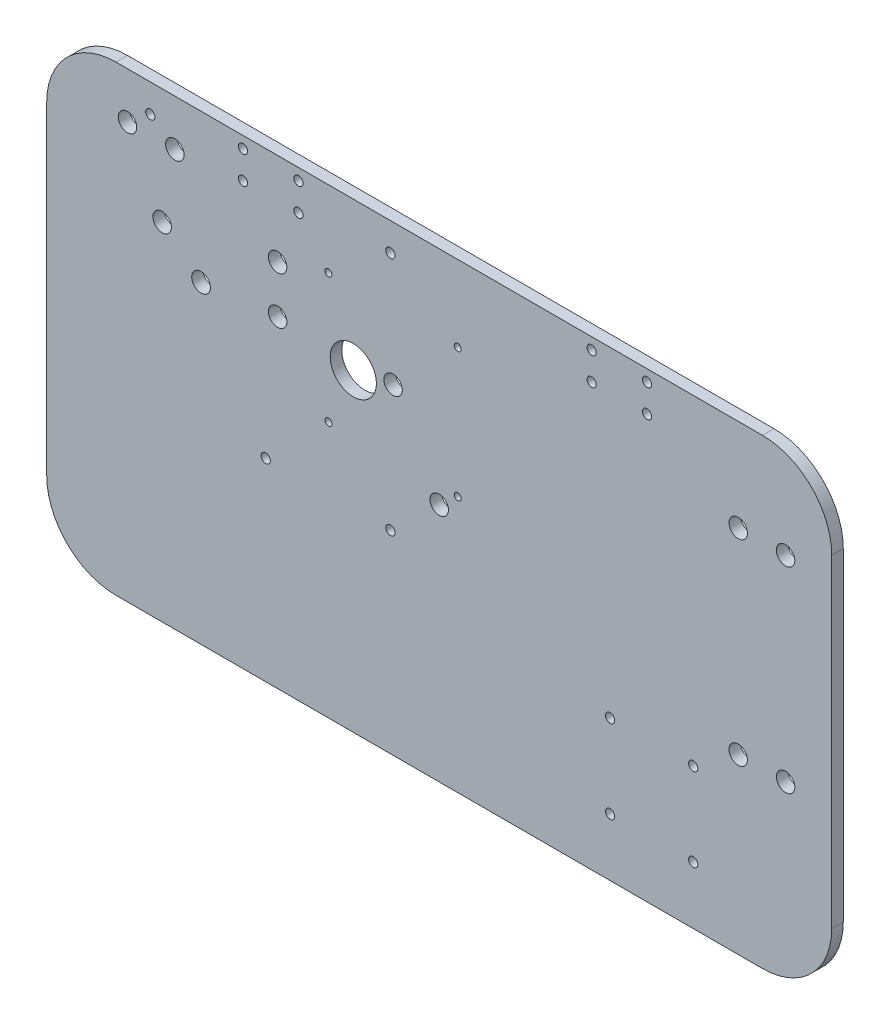
from build123d import *

# Parameters (mm, degrees)
SALIENTE_EXTRUIR1_DEPTH = 5
CROQUIS2_R              = 4
CORTAR_EXTRUIR4_DEPTH   = 10
CROQUIS3_R              = 2
CROQUIS3_R_2            = 10
CROQUIS3_R_3            = 4.05
CORTAR_EXTRUIR5_DEPTH   = 10
CROQUIS5_R              = 1.5
CORTAR_EXTRUIR6_DEPTH   = 10
CROQUIS6_R              = 2
CORTAR_EXTRUIR7_DEPTH   = 10
CROQUIS8_R              = 2
CORTAR_EXTRUIR8_DEPTH   = 10


with BuildPart() as part:
    # Croquis1 → Saliente-Extruir1 (new body)
    with BuildSketch(Plane.XY):
        with BuildLine():
            Line((30, 0), (310, 0))
            ThreePointArc((310, 0), (331.213203436, 8.786796564), (340, 30))
            Line((340, 30), (340, 170))
            ThreePointArc((340, 170), (331.213203436, 191.213203436), (310, 200))
            Line((310, 200), (30, 200))
            ThreePointArc((30, 200), (8.786796564, 191.213203436), (0, 170))
            Line((0, 170), (0, 30))
            ThreePointArc((0, 30), (8.786796564, 8.786796564), (30, 0))
        make_face()
    extrude(amount=SALIENTE_EXTRUIR1_DEPTH)

    # Croquis2 → Cortar-Extruir4 (cut)
    with BuildSketch(Plane(origin=(0, 0, 5), x_dir=(-1, 0, 0), z_dir=(0, 0, -1))):
        with Locations((-55.5, 180)):
            Circle(CROQUIS2_R)
        with Locations((-35, 180)):
            Circle(CROQUIS2_R)
        with Locations((-100, 160)):
            Circle(CROQUIS2_R)
        with Locations((-100, 139.5)):
            Circle(CROQUIS2_R)
        with Locations((-299.5, 160)):
            Circle(CROQUIS2_R)
        with Locations((-320, 160)):
            Circle(CROQUIS2_R)
        with Locations((-320, 75)):
            Circle(CROQUIS2_R)
        with Locations((-299.5, 75)):
            Circle(CROQUIS2_R)
        with Locations((-150, 139)):
            Circle(CROQUIS2_R)
        with Locations((-170, 104)):
            Circle(CROQUIS2_R)
        with Locations((-50, 150)):
            Circle(CROQUIS2_R)
    extrude(amount=CORTAR_EXTRUIR4_DEPTH, mode=Mode.SUBTRACT)

    # Croquis3 → Cortar-Extruir5 (cut)
    with BuildSketch(Plane(origin=(0, 0, 0), x_dir=(-1, 0, 0), z_dir=(0, 0, -1))):
        with Locations((-148.85, 83.84)):
            Circle(CROQUIS3_R)
        with Locations((-94.85, 83.84)):
            Circle(CROQUIS3_R)
        with Locations((-44.85, 187.84)):
            Circle(CROQUIS3_R)
        with Locations((-148.85, 187.84)):
            Circle(CROQUIS3_R)
        with Locations((-132.79, 135.84)):
            Circle(CROQUIS3_R_2)
        with Locations((-66.85, 135.84)):
            Circle(CROQUIS3_R_3)
    extrude(amount=-CORTAR_EXTRUIR5_DEPTH, mode=Mode.SUBTRACT)

    # Croquis5 → Cortar-Extruir6 (cut)
    with BuildSketch(Plane(origin=(0, 0, 0), x_dir=(-1, 0, 0), z_dir=(0, 0, -1))):
        with Locations((-178, 167)):
            Circle(CROQUIS5_R)
        with Locations((-122, 111)):
            Circle(CROQUIS5_R)
        with Locations((-122, 167)):
            Circle(CROQUIS5_R)
        with Locations((-178, 111)):
            Circle(CROQUIS5_R)
    extrude(amount=-CORTAR_EXTRUIR6_DEPTH, mode=Mode.SUBTRACT)

    # Croquis6 → Cortar-Extruir7 (cut)
    with BuildSketch(Plane.XY.offset(5)):
        with Locations((244, 61)):
            Circle(CROQUIS6_R)
        with Locations((280, 61)):
            Circle(CROQUIS6_R)
        with Locations((244, 25)):
            Circle(CROQUIS6_R)
        with Locations((280, 25)):
            Circle(CROQUIS6_R)
    extrude(amount=-CORTAR_EXTRUIR7_DEPTH, mode=Mode.SUBTRACT)

    # Croquis8 → Cortar-Extruir8 (cut)
    with BuildSketch(Plane.XY.offset(5)):
        with Locations((236, 195)):
            Circle(CROQUIS8_R)
        with Locations((236, 183)):
            Circle(CROQUIS8_R)
        with Locations((260, 183)):
            Circle(CROQUIS8_R)
        with Locations((260, 195)):
            Circle(CROQUIS8_R)
        with Locations((85, 195)):
            Circle(CROQUIS8_R)
        with Locations((85, 183)):
            Circle(CROQUIS8_R)
        with Locations((109, 183)):
            Circle(CROQUIS8_R)
        with Locations((109, 195)):
            Circle(CROQUIS8_R)
    extrude(amount=-CORTAR_EXTRUIR8_DEPTH, mode=Mode.SUBTRACT)


solid = part.part
